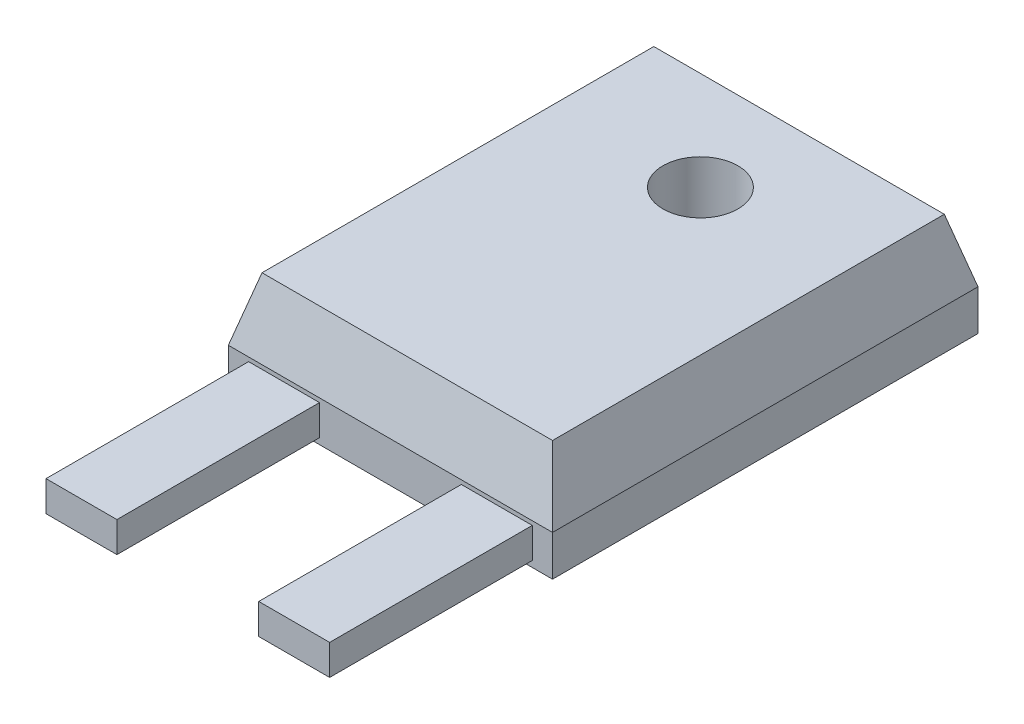
from build123d import *
from OCP.BRepFilletAPI import BRepFilletAPI_MakeChamfer

# Parameters (mm, degrees)
SKETCH1_W              = 16
SKETCH1_H              = 21
BOSS_EXTRUDE1_DEPTH    = 5.1
SKETCH2_R              = 1.85
CUT_EXTRUDE1_DEPTH     = 5.1
CHAMFER1_SIZE          = 3.1
CHAMFER1_SIZE2         = 0.830642497
SKETCH3_W              = 3.5
SKETCH3_H              = 1.5
BOSS_EXTRUDE2_DEPTH    = 10
CUT_EXTRUDE3_START     = -0.5
CUT_EXTRUDE3_OUTLINE_W = 13.8
CUT_EXTRUDE3_OUTLINE_H = 11.6
CUT_EXTRUDE3_DEPTH     = 0.5


# Read off the part's stored shape, not the designer's step: Cut-Extrude3
with BuildPart() as part:
    # Sketch1 → Boss-Extrude1 (new body)
    with BuildSketch(Plane(origin=(0, 0, 0), x_dir=(1, 0, 0), z_dir=(0, 1, 0))):
        with Locations((8, 10.5)):
            Rectangle(SKETCH1_W, SKETCH1_H)
    extrude(amount=BOSS_EXTRUDE1_DEPTH)

    # Sketch2 → Cut-Extrude1 (cut)
    with BuildSketch(Plane(origin=(0, 5.1, 0), x_dir=(1, 0, 0), z_dir=(0, 1, 0))):
        with Locations(Location((8, 15.3, 0), (0, 0, 270))):
            Circle(SKETCH2_R)
    extrude(amount=-CUT_EXTRUDE1_DEPTH, mode=Mode.SUBTRACT)

    # Chamfer1: one chamfer whose edges measure the first distance from different faces: ONE call of the kernel's chamfer builder (chamfer() names one face for all edges)
    chamfer1_edges_1 = [part.edges().sort_by_distance(p)[0] for p in [
        (16, 5.1, -10.5),
    ]]
    chamfer1_side_1 = [part.faces().sort_by_distance(p)[0] for p in [
        (16, 2.55, -10.5),
    ]]
    chamfer1_edges_2 = [part.edges().sort_by_distance(p)[0] for p in [
        (8, 5.1, -21),
    ]]
    chamfer1_side_2 = [part.faces().sort_by_distance(p)[0] for p in [
        (8, 2.55, -21),
    ]]
    chamfer1_edges_3 = [part.edges().sort_by_distance(p)[0] for p in [
        (0, 5.1, -10.5),
    ]]
    chamfer1_side_3 = [part.faces().sort_by_distance(p)[0] for p in [
        (0, 2.55, -10.5),
    ]]
    chamfer1_edges_4 = [part.edges().sort_by_distance(p)[0] for p in [
        (8, 5.1, 0),
    ]]
    chamfer1_side_4 = [part.faces().sort_by_distance(p)[0] for p in [
        (8, 2.55, 0),
    ]]
    chamfer1 = BRepFilletAPI_MakeChamfer(part.part.solid().wrapped)
    for e in chamfer1_edges_1:
        chamfer1.Add(CHAMFER1_SIZE, CHAMFER1_SIZE2, e.wrapped, chamfer1_side_1[0].wrapped)  # the first distance lies on this face
    for e in chamfer1_edges_2:
        chamfer1.Add(CHAMFER1_SIZE, CHAMFER1_SIZE2, e.wrapped, chamfer1_side_2[0].wrapped)  # the first distance lies on this face
    for e in chamfer1_edges_3:
        chamfer1.Add(CHAMFER1_SIZE, CHAMFER1_SIZE2, e.wrapped, chamfer1_side_3[0].wrapped)  # the first distance lies on this face
    for e in chamfer1_edges_4:
        chamfer1.Add(CHAMFER1_SIZE, CHAMFER1_SIZE2, e.wrapped, chamfer1_side_4[0].wrapped)  # the first distance lies on this face
    add(Compound.cast(chamfer1.Shape()), mode=Mode.REPLACE)

    # Sketch3 → Boss-Extrude2 (add)
    with BuildSketch(Plane.XY):
        with Locations((2.75, 1.05)):
            Rectangle(SKETCH3_W, SKETCH3_H)
        with Locations((13.25, 1.05)):
            Rectangle(SKETCH3_W, SKETCH3_H)
    extrude(amount=BOSS_EXTRUDE2_DEPTH)

    # Cut-Extrude3 outline → Cut-Extrude3 (cut)
    with BuildSketch(Plane(origin=(0, 0, 0), x_dir=(-1, 0, 0), z_dir=(0, -1, 0)).offset(CUT_EXTRUDE3_START)):
        with Locations((-8, 6.8)):
            Rectangle(CUT_EXTRUDE3_OUTLINE_W, CUT_EXTRUDE3_OUTLINE_H)
    extrude(amount=CUT_EXTRUDE3_DEPTH, mode=Mode.SUBTRACT)


solid = part.part
